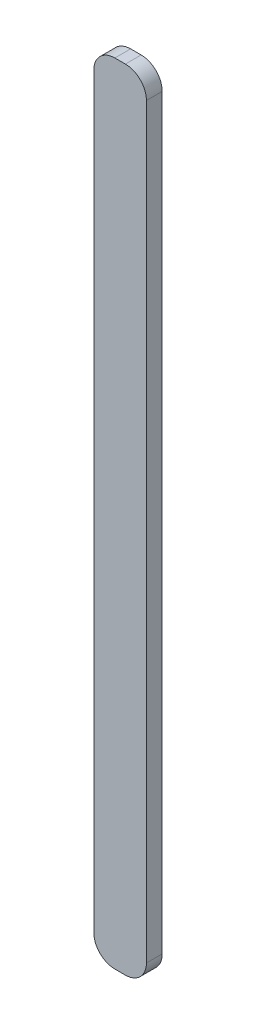
from build123d import *

# Parameters (mm, degrees)
SKETCH1_W           = 10
SKETCH1_H           = 150
BOSS_EXTRUDE1_DEPTH = 1.5
FILLET1_R           = 4


with BuildPart() as part:
    # Sketch1 → Boss-Extrude1 (new, symmetric)
    with BuildSketch(Plane.XY):
        Rectangle(SKETCH1_W, SKETCH1_H)
    extrude(amount=BOSS_EXTRUDE1_DEPTH, both=True)

    # Fillet1
    fillet1_edges = [part.edges().sort_by_distance(p)[0] for p in [
        (-5, -75, 0),
        (5, -75, 0),
        (-5, 75, 0),
        (5, 75, 0),
    ]]
    fillet(fillet1_edges, radius=FILLET1_R)


solid = part.part
